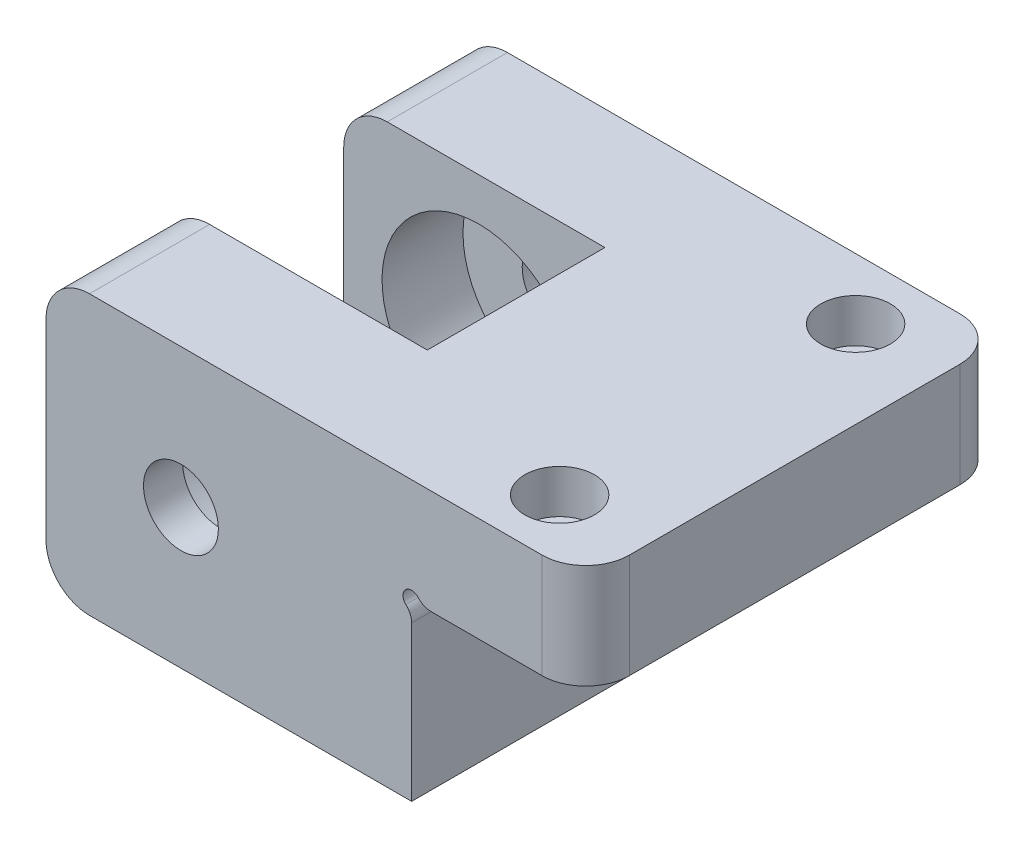
from build123d import *

# Parameters (mm, degrees)
DODANIE_WYCI_GNI_CIE1_DEPTH = 48
SZKIC4_W                    = 13.8
SZKIC4_H                    = 32
DODANIE_WYCI_GNI_CIE3_DEPTH = 30
SZKIC6_R                    = 11.1
WYTNIJ_WYCI_GNI_CIE1_DEPTH  = 72.3582511
SZKIC9_R                    = 4
WYTNIJ_WYCI_GNI_CIE4_DEPTH  = 5
SZKIC10_R                   = 2.1
WYTNIJ_WYCI_GNI_CIE5_DEPTH  = 5
ZAOKR_GLENIE1_R             = 5
ZAOKR_GLENIE2_R             = 5
SZKIC11_R                   = 11.1
DODANIE_WYCI_GNI_CIE5_DEPTH = 4.5
SZKIC12_R                   = 4.3
WYTNIJ_WYCI_GNI_CIE6_DEPTH  = 72.3582511


with BuildPart() as part:
    # Szkic1 → Dodanie-wyciągnięcie1 (new body)
    with BuildSketch(Plane.XY):
        with BuildLine():
            Line((0, 0), (0, 17.763932023))
            ThreePointArc((0, 17.763932023), (-0.174258142, 18.580428603), (-0.666666667, 19.254644008))
            ThreePointArc((-0.666666667, 19.254644008), (-0.707106781, 20.707106781), (0.745355992, 20.666666667))
            ThreePointArc((0.745355992, 20.666666667), (1.419571397, 20.174258142), (2.236067977, 20))
            Line((2.236067977, 20), (20, 20))
            Line((20, 20), (20, 32))
            Line((20, 32), (-12, 32))
            Line((-12, 32), (-12, 0))
            Line((-12, 0), (0, 0))
        make_face()
    extrude(amount=DODANIE_WYCI_GNI_CIE1_DEPTH)

    # Szkic4 → Dodanie-wyciągnięcie3 (add)
    with BuildSketch(Plane.ZY.offset(12)):
        with Locations((41.1, 16)):
            Rectangle(SZKIC4_W, SZKIC4_H)
        with Locations((6.9, 16)):
            Rectangle(SZKIC4_W, SZKIC4_H)
    extrude(amount=DODANIE_WYCI_GNI_CIE3_DEPTH)

    # Szkic6 → Wytnij-wyciągnięcie1 (cut, through all)
    with BuildSketch(Plane.XY.offset(48)):
        with Locations((-26.5, 16)):
            Circle(SZKIC6_R)
    extrude(amount=-WYTNIJ_WYCI_GNI_CIE1_DEPTH, mode=Mode.SUBTRACT)

    # Szkic9 → Wytnij-wyciągnięcie4 (cut)
    with BuildSketch(Plane(origin=(0, 32, 0), x_dir=(1, 0, 0), z_dir=(0, 1, 0))):
        with Locations((10, -7)):
            Circle(SZKIC9_R)
        with Locations((10, -41)):
            Circle(SZKIC9_R)
    extrude(amount=-WYTNIJ_WYCI_GNI_CIE4_DEPTH, mode=Mode.SUBTRACT)

    # Szkic10 → Wytnij-wyciągnięcie5 (cut)
    with BuildSketch(Plane(origin=(0, 27, 0), x_dir=(1, 0, 0), z_dir=(0, 1, 0))):
        with Locations((10, -7)):
            Circle(SZKIC10_R)
        with Locations((10, -41)):
            Circle(SZKIC10_R)
    extrude(amount=-WYTNIJ_WYCI_GNI_CIE5_DEPTH, mode=Mode.SUBTRACT)

    # Zaokrąglenie1
    zaokr_glenie1_edges = [part.edges().sort_by_distance(p)[0] for p in [
        (20, 26, 0),
        (20, 26, 48),
    ]]
    fillet(zaokr_glenie1_edges, radius=ZAOKR_GLENIE1_R)

    # Zaokrąglenie2
    zaokr_glenie2_edges = [part.edges().sort_by_distance(p)[0] for p in [
        (-42, 0, 6.9),
        (-42, 0, 41.1),
        (-42, 32, 41.1),
        (-42, 32, 6.9),
    ]]
    fillet(zaokr_glenie2_edges, radius=ZAOKR_GLENIE2_R)

    # Szkic11 → Dodanie-wyciągnięcie5 (add)
    with BuildSketch(Plane.XY.offset(48)):
        with Locations((-26.5, 16)):
            Circle(SZKIC11_R)
    dodanie_wyci_gni_cie5 = extrude(amount=-DODANIE_WYCI_GNI_CIE5_DEPTH)

    # Lustro1: Dodanie-wyciągnięcie5 across plane
    add(dodanie_wyci_gni_cie5.mirror(Plane.XY.offset(24)))

    # Szkic12 → Wytnij-wyciągnięcie6 (cut, through all)
    with BuildSketch(Plane.XY.offset(48)):
        with Locations((-26.5, 16)):
            Circle(SZKIC12_R)
    extrude(amount=-WYTNIJ_WYCI_GNI_CIE6_DEPTH, mode=Mode.SUBTRACT)


solid = part.part
